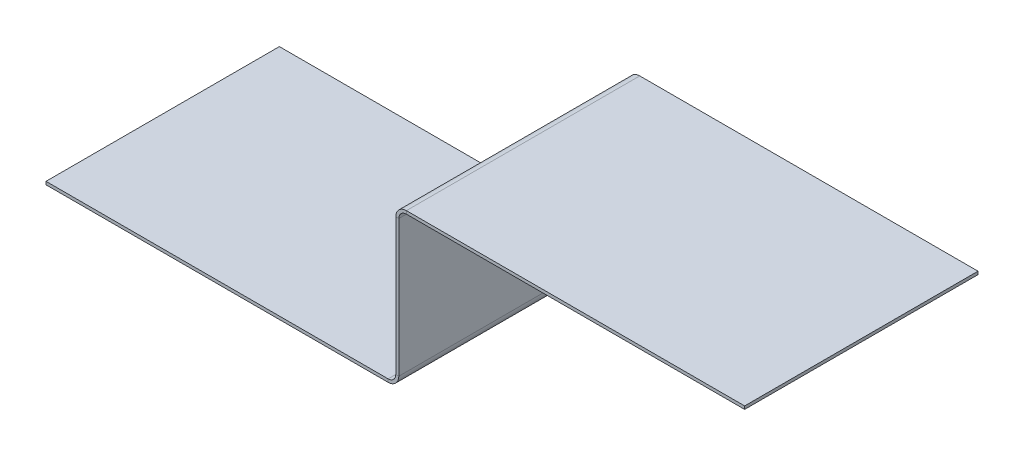
from build123d import *

# Parameters (mm, degrees)
SKETCH_1_W             = 230.160423268
SKETCH_1_H             = 76.880643476
SM_BASE_FLANGE_1_DEPTH = 1
OTHER_START            = -38.440321738
OTHER_1_DEPTH          = 76.880643476
OTHER_1_2_DEPTH        = 76.880643476


# Read off the part's stored shape, not the designer's step: 转折1
# Sheet-metal steps are written as plain solids
with BuildPart() as part:
    # Sketch 1 → 基体-法兰1 (new body)
    with BuildSketch(Plane(origin=(0, 0, 0), x_dir=(1, 0, 0), z_dir=(0, 1, 0))):
        Rectangle(SKETCH_1_W, SKETCH_1_H)
    extrude(amount=-SM_BASE_FLANGE_1_DEPTH)

    # Other 1 outline → Other 1 (cut)
    with BuildSketch(Plane.XY.offset(OTHER_START)):
        with BuildLine():
            Line((115.080211634, 0), (0.093295252, 0))
            ThreePointArc((0.093295252, 0), (-1.033318835, -0.740370349), (-2.35619449, -1))
            Line((-2.35619449, -1), (115.080211634, -1))
            Line((115.080211634, -1), (115.080211634, 0))
        make_face()
    extrude(amount=OTHER_1_DEPTH, mode=Mode.SUBTRACT)

    # Other 1 2 outline → Other 1 2 (add)
    with BuildSketch(Plane.XY.offset(OTHER_START)):
        with BuildLine():
            ThreePointArc((3.64380551, 51), (1.168931776, 49.974873734), (0.14380551, 47.5))
            Line((0.14380551, 47.5), (0.14380551, 2.5))
            ThreePointArc((0.14380551, 2.5), (-0.588427537, 0.732233047), (-2.35619449, 0))
            Line((-2.35619449, 0), (0.093295252, 0))
            ThreePointArc((0.093295252, 0), (0.870507704, 1.144126499), (1.14380551, 2.5))
            Line((1.14380551, 2.5), (1.14380551, 47.5))
            ThreePointArc((1.14380551, 47.5), (1.876038557, 49.267766953), (3.64380551, 50))
            Line((3.64380551, 50), (115.080211634, 50))
            Line((115.080211634, 50), (115.080211634, 51))
            Line((115.080211634, 51), (3.64380551, 51))
        make_face()
    extrude(amount=OTHER_1_2_DEPTH)


solid = part.part
